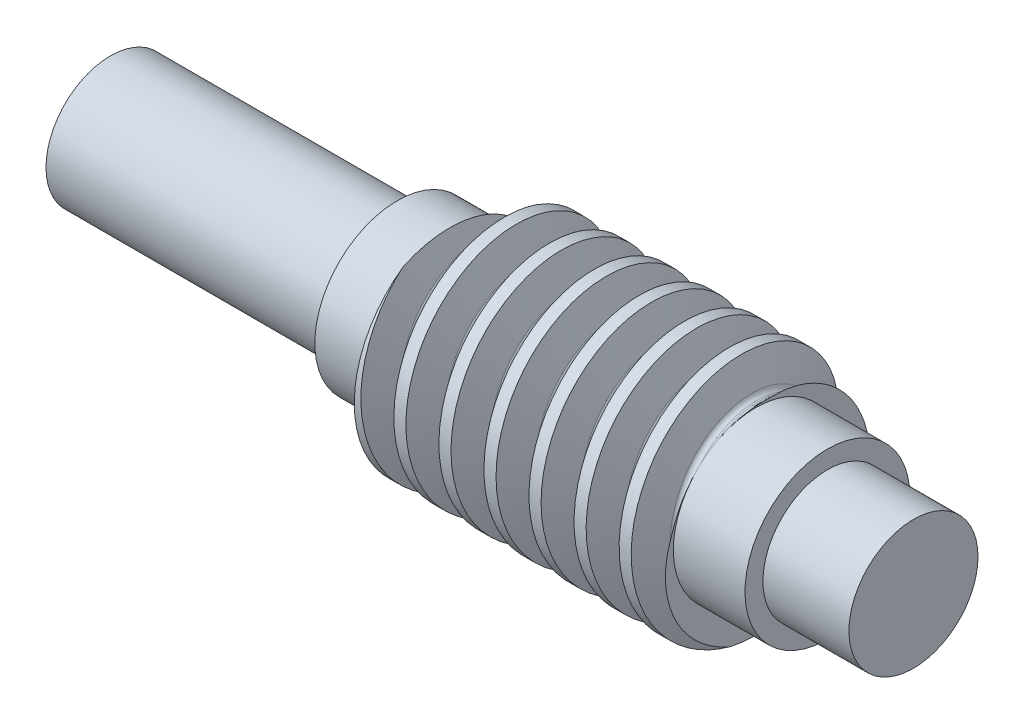
from build123d import *

# Parameters (mm, degrees)
SKETCH_1_W      = 20
SKETCH_1_H      = 8
SWEEP_1_PITCH   = 3.141592654
SKETCH_4_R      = 5.75
EXTRUDE_1_DEPTH = 5
EXTRUDE_START   = 5
SKETCH_5_R      = 5.75
EXTRUDE_2_DEPTH = 5
SKETCH_6_R      = 4.5
EXTRUDE_3_DEPTH = 20
EXTRUDE_START_2 = 6
SKETCH_7_R      = 4.5
EXTRUDE_4_DEPTH = 6


with BuildPart() as part:
    # 草图1 → 旋转1 (revolve)
    with BuildSketch(Plane.XY, mode=Mode.PRIVATE) as revolve_1_sk:
        with Locations((10, 4)):
            Rectangle(SKETCH_1_W, SKETCH_1_H)
    revolve(revolve_1_sk.sketch.rotate(Axis((-56.849408284, 0, 0), (1, 0, 0)), 90), axis=Axis((-56.849408284, 0, 0), (1, 0, 0)))

    # 切除-扫描1: the profile of 草图3 profile screwed along a right-hand helix of 9.740283 turns, 10 arcs to a turn; built about Z, then put on its axis
    sweep_1_z = Axis((0, 0, 0), (0, 0, 1))
    sweep_1_corners = [(8.0003, 0, -3.448214384), (8.0003, 0, -1.149259207), (6.000032346, 0, -1.877297093), (5.75, 0, -2.234380289), (5.75, 0, -2.363093301), (6.000032346, 0, -2.720176497)]
    with BuildLine(mode=Mode.PRIVATE) as sweep_1_profile:
        Line(sweep_1_corners[0], sweep_1_corners[1])
        Line(sweep_1_corners[1], sweep_1_corners[2])
        Line(sweep_1_corners[3], sweep_1_corners[4])
        Line(sweep_1_corners[5], sweep_1_corners[0])
        ThreePointArc((6.000032346, 0, -1.877297093), (5.818722223, 0, -2.016421243), (5.75, 0, -2.234380289))
        ThreePointArc((5.75, 0, -2.363093301), (5.818722223, 0, -2.581052347), (6.000032346, 0, -2.720176497))
    sweep_1_cap = Face(sweep_1_profile.wire())
    sweep_1_arcs = [((6.000032346, 0, -1.877297093), (5.75, 0, -1.968301425), (5.75, 0, -2.234380289), (1, 0.8191520442889896, 1)), ((5.75, 0, -2.363093301), (5.75, 0, -2.629172166), (6.000032346, 0, -2.720176497), (1, 0.8191520442889902, 1))]  # start, shoulder, end, weights
    sweep_1_turn_angles = [0, 18, 36, 54, 72, 90, 108, 126, 144, 162, 180, 198, 216, 234, 252, 270, 288, 306, 324, 342, 360]
    sweep_1_turn_weights = [1, 0.9510565162951535, 1, 0.9510565162951535, 1, 0.9510565162951535, 1, 0.9510565162951535, 1, 0.9510565162951535, 1, 0.9510565162951535, 1, 0.9510565162951535, 1, 0.9510565162951535, 1, 0.9510565162951535, 1, 0.9510565162951535, 1]
    sweep_1_turn_rails = [Edge.make_bspline([Vector(p[0], p[1], 0).rotate(sweep_1_z, sweep_1_turn_angles[k]) / sweep_1_turn_weights[k] + Vector(0, 0, p[2] + SWEEP_1_PITCH * sweep_1_turn_angles[k] / 360) for k in range(21)], [0, 0, 0, 1, 1, 2, 2, 3, 3, 4, 4, 5, 5, 6, 6, 7, 7, 8, 8, 9, 9, 10, 10, 10], 2, sweep_1_turn_weights) for p in sweep_1_corners]
    sweep_1_turn_sides = [*[Face.make_surface_from_curves(sweep_1_turn_rails[p[0]], sweep_1_turn_rails[p[1]]) for p in [(0, 1), (1, 2), (3, 4), (5, 0)]], *[Face.make_bezier_surface([[Vector(p[j][0], p[j][1], 0).rotate(sweep_1_z, sweep_1_turn_angles[2 * i + k]) / sweep_1_turn_weights[2 * i + k] + Vector(0, 0, p[j][2] + SWEEP_1_PITCH * sweep_1_turn_angles[2 * i + k] / 360) for k in range(3)] for j in range(3)], [[p[3][j] * sweep_1_turn_weights[2 * i + k] for k in range(3)] for j in range(3)]) for p in sweep_1_arcs for i in range(10)]]
    sweep_1_last_angles = [3240, 3258, 3276, 3294, 3312, 3330, 3348, 3366, 3384, 3402, 3420, 3438, 3456, 3474, 3492, 3499.2508531, 3506.501706201]
    sweep_1_last_weights = [1, 0.9510565162951535, 1, 0.9510565162951535, 1, 0.9510565162951535, 1, 0.9510565162951535, 1, 0.9510565162951535, 1, 0.9510565162951535, 1, 0.9510565162951535, 1, 0.9920030705416244, 1]
    sweep_1_last_rails = [Edge.make_bspline([Vector(p[0], p[1], 0).rotate(sweep_1_z, sweep_1_last_angles[k]) / sweep_1_last_weights[k] + Vector(0, 0, p[2] + SWEEP_1_PITCH * sweep_1_last_angles[k] / 360) for k in range(17)], [0, 0, 0, 1, 1, 2, 2, 3, 3, 4, 4, 5, 5, 6, 6, 7, 7, 8, 8, 8], 2, sweep_1_last_weights) for p in sweep_1_corners]
    sweep_1_last_sides = [*[Face.make_surface_from_curves(sweep_1_last_rails[p[0]], sweep_1_last_rails[p[1]]) for p in [(0, 1), (1, 2), (3, 4), (5, 0)]], *[Face.make_bezier_surface([[Vector(p[j][0], p[j][1], 0).rotate(sweep_1_z, sweep_1_last_angles[2 * i + k]) / sweep_1_last_weights[2 * i + k] + Vector(0, 0, p[j][2] + SWEEP_1_PITCH * sweep_1_last_angles[2 * i + k] / 360) for k in range(3)] for j in range(3)], [[p[3][j] * sweep_1_last_weights[2 * i + k] for k in range(3)] for j in range(3)]) for p in sweep_1_arcs for i in range(8)]]
    sweep_1 = Plane(origin=(0, 0, 0), x_dir=(0, 1, 0), z_dir=(1, 0, 0)) * Solid(Shell([*[p.moved(Location((0, 0, SWEEP_1_PITCH * i))) for i in range(9) for p in sweep_1_turn_sides], *sweep_1_last_sides, sweep_1_cap, sweep_1_cap.rotate(sweep_1_z, 3506.501706201).moved(Location((0, 0, SWEEP_1_PITCH * 3506.501706201 / 360)))]))
    add(sweep_1, mode=Mode.SUBTRACT)

    # 草图4 → 凸台-拉伸1 (add)
    with BuildSketch(Plane(origin=(0, 0, 0), x_dir=(0, 0, -1), z_dir=(1, 0, 0))):
        Circle(SKETCH_4_R)
    extrude(amount=-EXTRUDE_1_DEPTH)

    # 草图5 → 凸台-拉伸2 (add)
    with BuildSketch(Plane(origin=(20, 0, 0), x_dir=(0, 0, -1), z_dir=(1, 0, 0)).offset(EXTRUDE_START)):
        Circle(SKETCH_5_R)
    extrude(amount=-EXTRUDE_2_DEPTH)

    # 草图6 → 凸台-拉伸3 (add)
    with BuildSketch(Plane.ZY.offset(5)):
        with Locations(Location((0, 0, 0), (0, 0, 180))):
            Circle(SKETCH_6_R)
    extrude(amount=EXTRUDE_3_DEPTH)

    # 草图7 → 凸台-拉伸4 (add)
    with BuildSketch(Plane(origin=(25, 0, 0), x_dir=(0, 0, -1), z_dir=(1, 0, 0)).offset(EXTRUDE_START_2)):
        Circle(SKETCH_7_R)
    extrude(amount=-EXTRUDE_4_DEPTH)


solid = part.part
